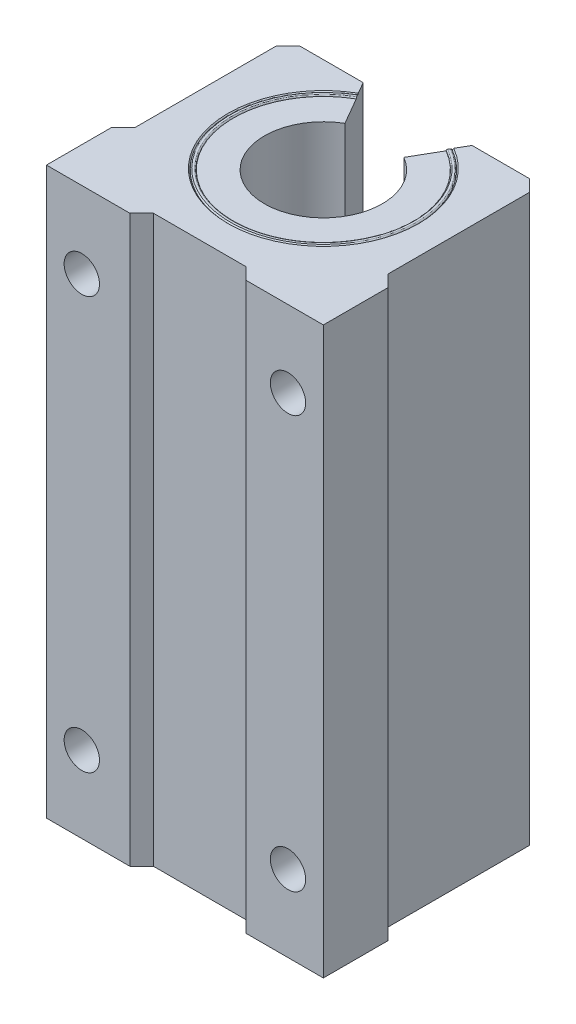
from build123d import *

# Parameters (mm, degrees)
EXTRUDE_2_DEPTH     = 96
CHAMFER_1_SIZE      = 2
SKETCH_5_R          = 3
CUT_EXTRUDE_1_DEPTH = 12
CHAMFER_2_SIZE      = 2


with BuildPart() as part:
    # 草图4 → 拉伸2 (new body)
    with BuildSketch(Plane(origin=(0, -48, 0), x_dir=(-1, 0, 0), z_dir=(0, 1, 0))):
        with BuildLine():
            Line((7.833333333, 21), (-7.833333333, 21))
            Line((-7.833333333, 21), (-7.833333333, 23))
            Line((-7.833333333, 23), (-23, 23))
            Line((-23, 23), (-23, 12))
            Line((-23, 12), (-21, 10))
            Line((-21, 10), (-21, -16))
            Line((-21, -16), (-9.237604307, -16))
            Line((-9.237604307, -16), (-5, -8.660254038))
            ThreePointArc((-5, -8.660254038), (0, 10), (5, -8.660254038))
            Line((5, -8.660254038), (9.237604307, -16))
            Line((9.237604307, -16), (22, -16))
            Line((22, -16), (22, 10))
            Line((22, 10), (24, 12))
            Line((24, 12), (24, 23))
            Line((24, 23), (7.833333333, 23))
            Line((7.833333333, 23), (7.833333333, 21))
        make_face()
    extrude(amount=EXTRUDE_2_DEPTH)

    # 倒角1
    chamfer_1_edges = [part.edges().sort_by_distance(p)[0] for p in [
        (-7.833333333, 0, 23),
        (7.833333333, 0, 23),
    ]]
    chamfer(chamfer_1_edges, length=CHAMFER_1_SIZE - 0.0001)  # a hair under: the kernel refuses the full size

    # 草图5 → 切除-拉伸1 (cut)
    with BuildSketch(Plane.XY.offset(23)):
        with Locations((-18, 35)):
            Circle(SKETCH_5_R)
        with Locations((17, 35)):
            Circle(SKETCH_5_R)
        with Locations((17, -35)):
            Circle(SKETCH_5_R)
        with Locations((-18, -35)):
            Circle(SKETCH_5_R)
    extrude(amount=-CUT_EXTRUDE_1_DEPTH, mode=Mode.SUBTRACT)

    # 倒角2
    chamfer_2_edges = [part.edges().sort_by_distance(p)[0] for p in [
        (-22, 0, -16),
        (21, 0, -16),
    ]]
    chamfer(chamfer_2_edges, length=CHAMFER_2_SIZE)

    # 草图6 → 切除-旋转1 (revolve, cut)
    with BuildSketch(Plane(origin=(0, 0, 0), x_dir=(0, 0, -1), z_dir=(1, 0, 0))):
        with BuildLine():
            Line((-16.2, -48), (-16, -47.8))
            ThreePointArc((-16, -47.8), (-15.940621125, -47.941496067), (-15.798761062, -48))
            Line((-15.798761062, -48), (-16.2, -48))
        make_face()
        with BuildLine():
            Line((-15.45, -48), (0, -48))
            Line((0, -48), (0, -47.8))
            Line((0, -47.8), (-15.25, -47.8))
            ThreePointArc((-15.25, -47.8), (-15.308578644, -47.941421356), (-15.45, -48))
        make_face()
    cut_revolve_1 = revolve(axis=Axis((0, -10.264906919, 0), (0, -1, 0)), mode=Mode.SUBTRACT)

    # 镜向1: 切除-旋转1 across plane
    add(cut_revolve_1.mirror(Plane.ZX), mode=Mode.SUBTRACT)


solid = part.part
